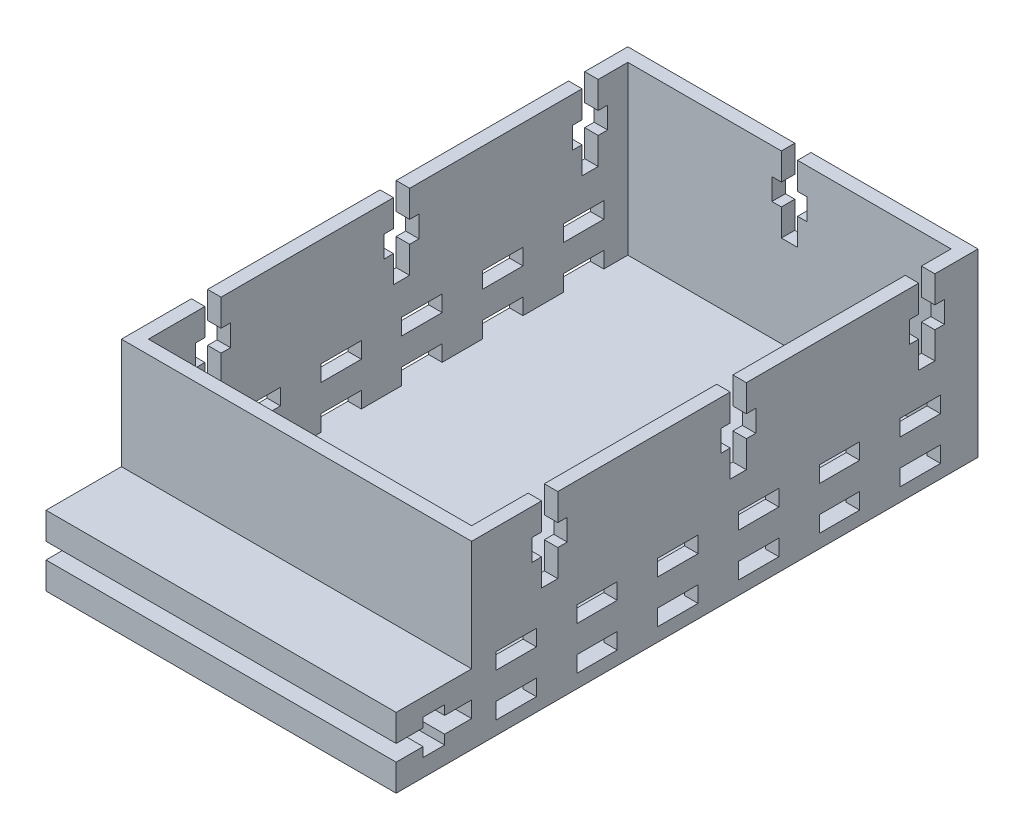
from build123d import *

# Parameters (mm, degrees)
SKETCH1_W                 = 60
SKETCH1_H                 = 89
BOSS_EXTRUDE1_DEPTH       = 2.5
SKETCH3_W                 = 65
SKETCH3_H                 = 94
SKETCH3_W_2               = 60
SKETCH3_H_2               = 89
BOSS_EXTRUDE2_DEPTH       = 33.5
SKETCH5_W                 = 7.5
SKETCH5_H                 = 3
CUT_EXTRUDE1_DEPTH        = 67.238206497
LPATTERN1_COUNT           = 6
LPATTERN1_PITCH           = 15
LPATTERN2_COPY_1_SKETCH_W = 7.5
LPATTERN2_COPY_1_SKETCH_H = 3
LPATTERN2_COPY_1_DEPTH    = 67.238206497
LPATTERN2_COPY_2_SKETCH_W = 7.5
LPATTERN2_COPY_2_SKETCH_H = 3
LPATTERN2_COPY_2_DEPTH    = 67.238206497
LPATTERN2_COPY_3_SKETCH_W = 7.5
LPATTERN2_COPY_3_SKETCH_H = 3
LPATTERN2_COPY_3_DEPTH    = 67.238206497
LPATTERN2_COPY_4_SKETCH_W = 7.5
LPATTERN2_COPY_4_SKETCH_H = 3
LPATTERN2_COPY_4_DEPTH    = 67.238206497
LPATTERN2_COPY_5_SKETCH_W = 7.5
LPATTERN2_COPY_5_SKETCH_H = 3
LPATTERN2_COPY_5_DEPTH    = 67.238206497
LPATTERN2_COPY_6_SKETCH_W = 7.5
LPATTERN2_COPY_6_SKETCH_H = 3
LPATTERN2_COPY_6_DEPTH    = 67.238206497
SKETCH6_W                 = 65
SKETCH6_H                 = 14
BOSS_EXTRUDE3_DEPTH       = 13
CUT_EXTRUDE2_DEPTH        = 77.808202687
CUT_EXTRUDE2_DEPTH_BACK   = 77.808202687
CUT_EXTRUDE3_DEPTH        = 77.808202687
LPATTERN3_COUNT           = 3
LPATTERN3_PITCH           = 35
CUT_EXTRUDE4_REACH        = 78.808


with BuildPart() as part:
    # Sketch1 → Boss-Extrude1 (new body)
    with BuildSketch(Plane(origin=(0, 0, 0), x_dir=(1, 0, 0), z_dir=(0, 1, 0))):
        Rectangle(SKETCH1_W, SKETCH1_H)
    extrude(amount=BOSS_EXTRUDE1_DEPTH)

    # Sketch3 → Boss-Extrude2 (add)
    with BuildSketch(Plane(origin=(0, 0, 0), x_dir=(1, 0, 0), z_dir=(0, 1, 0))):
        Rectangle(SKETCH3_W, SKETCH3_H)
        Rectangle(SKETCH3_W_2, SKETCH3_H_2, mode=Mode.SUBTRACT)
    extrude(amount=BOSS_EXTRUDE2_DEPTH)

    # Sketch5 → Cut-Extrude1 (cut, symmetric)
    with BuildSketch(Plane(origin=(0, 0, 0), x_dir=(0, 0, -1), z_dir=(1, 0, 0))):
        with Locations((-38.715113754, 4)):
            Rectangle(SKETCH5_W, SKETCH5_H)
    cut_extrude1 = extrude(amount=CUT_EXTRUDE1_DEPTH, both=True, mode=Mode.SUBTRACT)

    # LPattern1: Cut-Extrude1 ×6
    with Locations(*[(0, 0, -i * LPATTERN1_PITCH) for i in range(1, LPATTERN1_COUNT)]):
        add(cut_extrude1, mode=Mode.SUBTRACT)

    # LPattern2 copy 1 sketch → LPattern2 copy 1 (cut, symmetric)
    with BuildSketch(Plane(origin=(0, 8, -15), x_dir=(0, 0, -1), z_dir=(1, 0, 0))):
        with Locations((-38.715113754, 4)):
            Rectangle(LPATTERN2_COPY_1_SKETCH_W, LPATTERN2_COPY_1_SKETCH_H)
    extrude(amount=LPATTERN2_COPY_1_DEPTH, both=True, mode=Mode.SUBTRACT)

    # LPattern2 copy 2 sketch → LPattern2 copy 2 (cut, symmetric)
    with BuildSketch(Plane(origin=(0, 8, -30), x_dir=(0, 0, -1), z_dir=(1, 0, 0))):
        with Locations((-38.715113754, 4)):
            Rectangle(LPATTERN2_COPY_2_SKETCH_W, LPATTERN2_COPY_2_SKETCH_H)
    extrude(amount=LPATTERN2_COPY_2_DEPTH, both=True, mode=Mode.SUBTRACT)

    # LPattern2 copy 3 sketch → LPattern2 copy 3 (cut, symmetric)
    with BuildSketch(Plane(origin=(0, 8, -45), x_dir=(0, 0, -1), z_dir=(1, 0, 0))):
        with Locations((-38.715113754, 4)):
            Rectangle(LPATTERN2_COPY_3_SKETCH_W, LPATTERN2_COPY_3_SKETCH_H)
    extrude(amount=LPATTERN2_COPY_3_DEPTH, both=True, mode=Mode.SUBTRACT)

    # LPattern2 copy 4 sketch → LPattern2 copy 4 (cut, symmetric)
    with BuildSketch(Plane(origin=(0, 8, -60), x_dir=(0, 0, -1), z_dir=(1, 0, 0))):
        with Locations((-38.715113754, 4)):
            Rectangle(LPATTERN2_COPY_4_SKETCH_W, LPATTERN2_COPY_4_SKETCH_H)
    extrude(amount=LPATTERN2_COPY_4_DEPTH, both=True, mode=Mode.SUBTRACT)

    # LPattern2 copy 5 sketch → LPattern2 copy 5 (cut, symmetric)
    with BuildSketch(Plane(origin=(0, 8, -75), x_dir=(0, 0, -1), z_dir=(1, 0, 0))):
        with Locations((-38.715113754, 4)):
            Rectangle(LPATTERN2_COPY_5_SKETCH_W, LPATTERN2_COPY_5_SKETCH_H)
    extrude(amount=LPATTERN2_COPY_5_DEPTH, both=True, mode=Mode.SUBTRACT)

    # LPattern2 copy 6 sketch → LPattern2 copy 6 (cut, symmetric)
    with BuildSketch(Plane(origin=(0, 8, 0), x_dir=(0, 0, -1), z_dir=(1, 0, 0))):
        with Locations((-38.715113754, 4)):
            Rectangle(LPATTERN2_COPY_6_SKETCH_W, LPATTERN2_COPY_6_SKETCH_H)
    extrude(amount=LPATTERN2_COPY_6_DEPTH, both=True, mode=Mode.SUBTRACT)

    # Sketch6 → Boss-Extrude3 (add)
    with BuildSketch(Plane(origin=(0, 0, 0), x_dir=(1, 0, 0), z_dir=(0, 1, 0))):
        with Locations((0, -54)):
            Rectangle(SKETCH6_W, SKETCH6_H)
    extrude(amount=BOSS_EXTRUDE3_DEPTH)

    # Sketch7 → Cut-Extrude2 (cut, two sides: drawn at the far end of the back side and taken through both)
    with BuildSketch(Plane(origin=(0, 0, 0), x_dir=(0, 0, -1), z_dir=(1, 0, 0)).offset(-CUT_EXTRUDE2_DEPTH_BACK)):
        Polygon((-61, 8), (-56, 8), (-56, 9.75), (-52, 9.75), (-52, 8), (-47, 8), (-47, 5), (-52, 5), (-52, 3.25), (-56, 3.25), (-56, 5), (-61, 5), align=None)
    extrude(amount=CUT_EXTRUDE2_DEPTH + CUT_EXTRUDE2_DEPTH_BACK, mode=Mode.SUBTRACT)

    # Sketch11 → Cut-Extrude3 (cut, symmetric)
    with BuildSketch(Plane(origin=(0, 0, 0), x_dir=(0, 0, -1), z_dir=(1, 0, 0))):
        Polygon((39, 33.5), (39, 28.5), (40.75, 28.5), (40.75, 24.5), (39, 24.5), (39, 19.5), (36, 19.5), (36, 24.5), (34.25, 24.5), (34.25, 28.5), (36, 28.5), (36, 33.5), align=None)
    cut_extrude3 = extrude(amount=CUT_EXTRUDE3_DEPTH, both=True, mode=Mode.SUBTRACT)

    # LPattern3: Cut-Extrude3 ×3
    with Locations(*[(0, 0, i * LPATTERN3_PITCH) for i in range(1, LPATTERN3_COUNT)]):
        add(cut_extrude3, mode=Mode.SUBTRACT)

    # Sketch12 → Cut-Extrude4 (cut, up to next)
    with BuildSketch(Plane.XY, mode=Mode.PRIVATE) as cut_extrude4_sk1:
        Polygon((1.5, 33.5), (1.5, 28.5), (3.25, 28.5), (3.25, 24.5), (1.5, 24.5), (1.5, 19.5), (-1.5, 19.5), (-1.5, 24.5), (-3.25, 24.5), (-3.25, 28.5), (-1.5, 28.5), (-1.5, 33.5), align=None)
    cut_extrude4_tool1 = extrude(cut_extrude4_sk1.sketch, amount=-CUT_EXTRUDE4_REACH, mode=Mode.PRIVATE) & part.part
    add(cut_extrude4_tool1.solids().sort_by_distance((0, 26.5, 0))[0], mode=Mode.SUBTRACT)


solid = part.part
